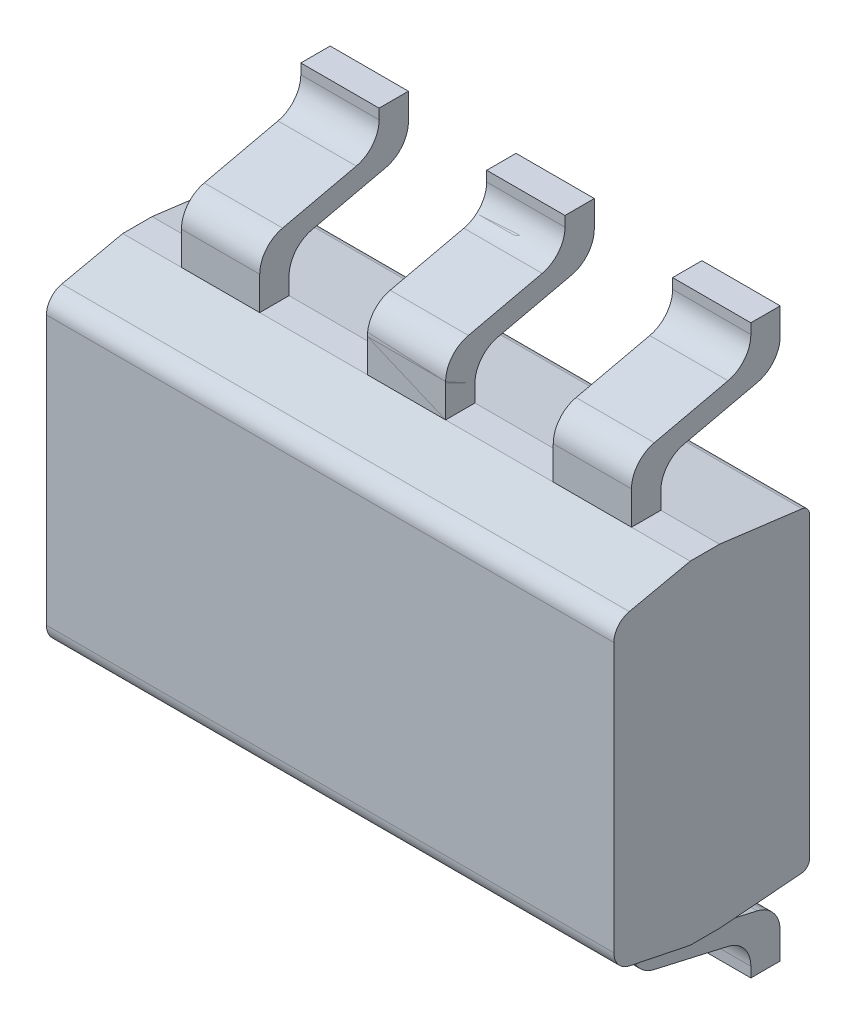
from build123d import *

# Parameters (mm, degrees)
ESQUISSE1_W                     = 2.9
ESQUISSE1_H                     = 1.7
BOSS_EXTRU_1_DEPTH              = 0.075
BOSS_EXTRU_2_DEPTH              = 1.45
BOSS_EXTRU_3_DEPTH              = 0.2
R_P_TITION_LIN_AIRE1_COUNT      = 2
R_P_TITION_LIN_AIRE1_PITCH      = 0.95
R_P_TITION_LIN_AIRE1_COUNT_DIR2 = 2
R_P_TITION_LIN_AIRE1_PITCH_DIR2 = 0.95
SYM_TRIE1_COPY_1_DEPTH          = 0.2
SYM_TRIE1_COPY_2_DEPTH          = 0.2
SYM_TRIE1_COPY_3_DEPTH          = 0.2


with BuildPart() as part:
    # Esquisse1 → Boss.-Extru.1 (new, symmetric)
    with BuildSketch(Plane.XY):
        Rectangle(ESQUISSE1_W, ESQUISSE1_H)
    extrude(amount=BOSS_EXTRU_1_DEPTH, both=True)

    # Esquisse3 → Boss.-Extru.2 (add, symmetric)
    with BuildSketch(Plane(origin=(0, 0, 0), x_dir=(0, 0, -1), z_dir=(1, 0, 0))):
        with BuildLine():
            Line((0.075, 0.85), (0.075, -0.85))
            Line((0.075, -0.85), (0.494172018, -0.815996143))
            ThreePointArc((0.494172018, -0.815996143), (0.523234947, -0.801834814), (0.535, -0.771722017))
            Line((0.535, -0.771722017), (0.535, 0.752220004))
            ThreePointArc((0.535, 0.752220004), (0.52391745, 0.781575433), (0.496199925, 0.796282676))
            Line((0.496199925, 0.796282676), (0.075, 0.85))
        make_face()
        with BuildLine():
            Line((-0.075, 0.85), (-0.075, -0.85))
            Line((-0.075, -0.85), (-0.385091212, -0.78640211))
            ThreePointArc((-0.385091212, -0.78640211), (-0.4424891, -0.751650671), (-0.465, -0.688441183))
            Line((-0.465, -0.688441183), (-0.465, 0.684700545))
            ThreePointArc((-0.465, 0.684700545), (-0.442852126, 0.747462369), (-0.38621907, 0.782423373))
            Line((-0.38621907, 0.782423373), (-0.075, 0.85))
        make_face()
    extrude(amount=BOSS_EXTRU_2_DEPTH, both=True)


with BuildPart() as body_2:
    # Esquisse5 → Boss.-Extru.3 (new, symmetric)
    with BuildSketch(Plane(origin=(0, 0, 0), x_dir=(0, 0, -1), z_dir=(1, 0, 0))):
        with BuildLine():
            Line((-0.075, 0.85), (-0.075, 1.019617275))
            ThreePointArc((-0.075, 1.019617275), (-0.042272533, 1.113143491), (0.041628708, 1.165858025))
            Line((0.041628708, 1.165858025), (0.418371292, 1.251828501))
            ThreePointArc((0.418371292, 1.251828501), (0.502272533, 1.304543034), (0.535, 1.39806925))
            Line((0.535, 1.39806925), (0.535, 1.45))
            Line((0.535, 1.45), (0.685, 1.45))
            Line((0.685, 1.45), (0.685, 1.315513616))
            ThreePointArc((0.685, 1.315513616), (0.652272533, 1.2219874), (0.568371292, 1.169272867))
            Line((0.568371292, 1.169272867), (0.191628708, 1.083302391))
            ThreePointArc((0.191628708, 1.083302391), (0.107727467, 1.030587857), (0.075, 0.937061641))
            Line((0.075, 0.937061641), (0.075, 0.85))
            Line((0.075, 0.85), (-0.075, 0.85))
        make_face()
    boss_extru_3 = extrude(amount=BOSS_EXTRU_3_DEPTH, both=True)


with BuildPart() as r_p_tition_lin_aire1_1:
    # Répétition linéaire1: Boss.-Extru.3 2 × 2
    with Locations(*[Vector(-1, 0, 0) * (i * R_P_TITION_LIN_AIRE1_PITCH) + Vector(1, 0, 0) * (j * R_P_TITION_LIN_AIRE1_PITCH_DIR2) for i in range(R_P_TITION_LIN_AIRE1_COUNT) for j in range(R_P_TITION_LIN_AIRE1_COUNT_DIR2) if (i, j) != (0, 0)]):
        add(boss_extru_3)


with BuildPart() as part_1:
    add(part.part)

    # Symétrie1: Boss.-Extru.3 across plane
    add(boss_extru_3.mirror(Plane.ZX))

    # Symétrie1 copy 1 sketch → Symétrie1 copy 1 (add, symmetric)
    with BuildSketch(Plane(origin=(0.95, 0, 0), x_dir=(0, 0, -1), z_dir=(1, 0, 0))):
        with BuildLine():
            Line((-0.075, -0.85), (-0.075, -1.019617275))
            ThreePointArc((-0.075, -1.019617275), (-0.042272533, -1.113143491), (0.041628708, -1.165858025))
            Line((0.041628708, -1.165858025), (0.418371292, -1.251828501))
            ThreePointArc((0.418371292, -1.251828501), (0.502272533, -1.304543034), (0.535, -1.39806925))
            Line((0.535, -1.39806925), (0.535, -1.45))
            Line((0.535, -1.45), (0.685, -1.45))
            Line((0.685, -1.45), (0.685, -1.315513616))
            ThreePointArc((0.685, -1.315513616), (0.652272533, -1.2219874), (0.568371292, -1.169272867))
            Line((0.568371292, -1.169272867), (0.191628708, -1.083302391))
            ThreePointArc((0.191628708, -1.083302391), (0.107727467, -1.030587857), (0.075, -0.937061641))
            Line((0.075, -0.937061641), (0.075, -0.85))
            Line((0.075, -0.85), (-0.075, -0.85))
        make_face()
    extrude(amount=SYM_TRIE1_COPY_1_DEPTH, both=True)

    # Symétrie1 copy 2 sketch → Symétrie1 copy 2 (add, symmetric)
    with BuildSketch(Plane(origin=(-0.95, 0, 0), x_dir=(0, 0, -1), z_dir=(1, 0, 0))):
        with BuildLine():
            Line((-0.075, -0.85), (-0.075, -1.019617275))
            ThreePointArc((-0.075, -1.019617275), (-0.042272533, -1.113143491), (0.041628708, -1.165858025))
            Line((0.041628708, -1.165858025), (0.418371292, -1.251828501))
            ThreePointArc((0.418371292, -1.251828501), (0.502272533, -1.304543034), (0.535, -1.39806925))
            Line((0.535, -1.39806925), (0.535, -1.45))
            Line((0.535, -1.45), (0.685, -1.45))
            Line((0.685, -1.45), (0.685, -1.315513616))
            ThreePointArc((0.685, -1.315513616), (0.652272533, -1.2219874), (0.568371292, -1.169272867))
            Line((0.568371292, -1.169272867), (0.191628708, -1.083302391))
            ThreePointArc((0.191628708, -1.083302391), (0.107727467, -1.030587857), (0.075, -0.937061641))
            Line((0.075, -0.937061641), (0.075, -0.85))
            Line((0.075, -0.85), (-0.075, -0.85))
        make_face()
    extrude(amount=SYM_TRIE1_COPY_2_DEPTH, both=True)

    # Symétrie1 copy 3 sketch → Symétrie1 copy 3 (add, symmetric)
    with BuildSketch(Plane(origin=(0, 0, 0), x_dir=(0, 0, -1), z_dir=(1, 0, 0))):
        with BuildLine():
            Line((-0.075, -0.85), (-0.075, -1.019617275))
            ThreePointArc((-0.075, -1.019617275), (-0.042272533, -1.113143491), (0.041628708, -1.165858025))
            Line((0.041628708, -1.165858025), (0.418371292, -1.251828501))
            ThreePointArc((0.418371292, -1.251828501), (0.502272533, -1.304543034), (0.535, -1.39806925))
            Line((0.535, -1.39806925), (0.535, -1.45))
            Line((0.535, -1.45), (0.685, -1.45))
            Line((0.685, -1.45), (0.685, -1.315513616))
            ThreePointArc((0.685, -1.315513616), (0.652272533, -1.2219874), (0.568371292, -1.169272867))
            Line((0.568371292, -1.169272867), (0.191628708, -1.083302391))
            ThreePointArc((0.191628708, -1.083302391), (0.107727467, -1.030587857), (0.075, -0.937061641))
            Line((0.075, -0.937061641), (0.075, -0.85))
            Line((0.075, -0.85), (-0.075, -0.85))
        make_face()
    extrude(amount=SYM_TRIE1_COPY_3_DEPTH, both=True)


solid = Compound([body_2.part, r_p_tition_lin_aire1_1.part, part_1.part])
